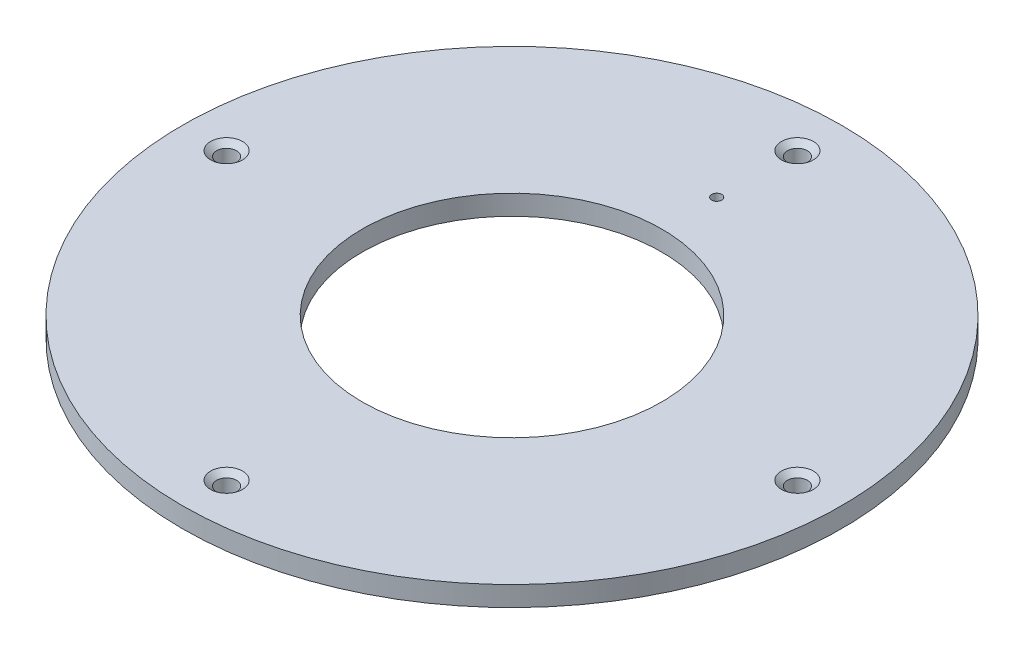
from build123d import *

# Parameters (mm, degrees)
SKETCH1_R                                       = 16.5
BOSS_EXTRUDE1_DEPTH                             = 1
CUT_EXTRUDE1_DEPTH                              = 24.355941428
CUT_EXTRUDE1_DEPTH_BACK                         = 24.355941428
SKETCH2_R                                       = 7.5
CUT_EXTRUDE2_DEPTH                              = 24.355941428
CUT_EXTRUDE2_DEPTH_BACK                         = 24.355941428
SKETCH4_R                                       = 0.25
CSK_FOR_M2_FLAT_HEAD_MACHINE_SCREW1_D           = 1
CSK_FOR_M2_FLAT_HEAD_MACHINE_SCREW1_CSINK_D     = 1.6
CSK_FOR_M2_FLAT_HEAD_MACHINE_SCREW1_CSINK_ANGLE = 100


with BuildPart() as part:
    # Sketch1 → Boss-Extrude1 (new body)
    with BuildSketch(Plane(origin=(0, 0, 0), x_dir=(1, 0, 0), z_dir=(0, 1, 0))):
        Circle(SKETCH1_R)
    extrude(amount=BOSS_EXTRUDE1_DEPTH)

    # Sketch2 → Cut-Extrude1 (cut, two sides: drawn at the far end of the back side and taken through both)
    with BuildSketch(Plane(origin=(0, 1, 0), x_dir=(1, 0, 0), z_dir=(0, 1, 0)).offset(-CUT_EXTRUDE1_DEPTH_BACK)):
        Circle(SKETCH2_R)
    extrude(amount=CUT_EXTRUDE1_DEPTH + CUT_EXTRUDE1_DEPTH_BACK, mode=Mode.SUBTRACT)

    # Sketch4 → Cut-Extrude2 (cut, two sides: drawn at the far end of the back side and taken through both)
    with BuildSketch(Plane(origin=(0, 1, 0), x_dir=(1, 0, 0), z_dir=(0, 1, 0)).offset(-CUT_EXTRUDE2_DEPTH_BACK)):
        with Locations((0, 10.25)):
            Circle(SKETCH4_R)
    extrude(amount=CUT_EXTRUDE2_DEPTH + CUT_EXTRUDE2_DEPTH_BACK, mode=Mode.SUBTRACT)

    # CSK for M2 Flat Head Machine Screw1 (through all)
    with Locations(Plane(origin=(0, 1, 0), x_dir=(1, 0, 0), z_dir=(0, 1, 0))):
        with Locations((0, 14.29), (14.29, 0), (0, -14.29), (-14.29, 0)):
            CounterSinkHole(CSK_FOR_M2_FLAT_HEAD_MACHINE_SCREW1_D / 2, CSK_FOR_M2_FLAT_HEAD_MACHINE_SCREW1_CSINK_D / 2, counter_sink_angle=CSK_FOR_M2_FLAT_HEAD_MACHINE_SCREW1_CSINK_ANGLE)


solid = part.part
